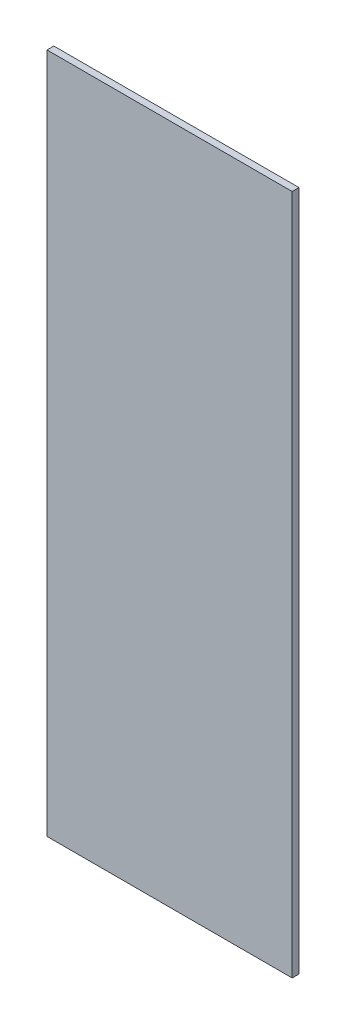
from build123d import *

# Parameters (mm, degrees)
SKETCH1_W           = 317.5
SKETCH1_H           = 114.3
BOSS_EXTRUDE1_DEPTH = 3.175


with BuildPart() as part:
    # Sketch1 → Boss-Extrude1 (new body)
    with BuildSketch(Plane(origin=(0, 0, 0), x_dir=(0, 1, 0), z_dir=(0, 0, 1))):
        Rectangle(SKETCH1_W, SKETCH1_H)
    extrude(amount=BOSS_EXTRUDE1_DEPTH)


solid = part.part
